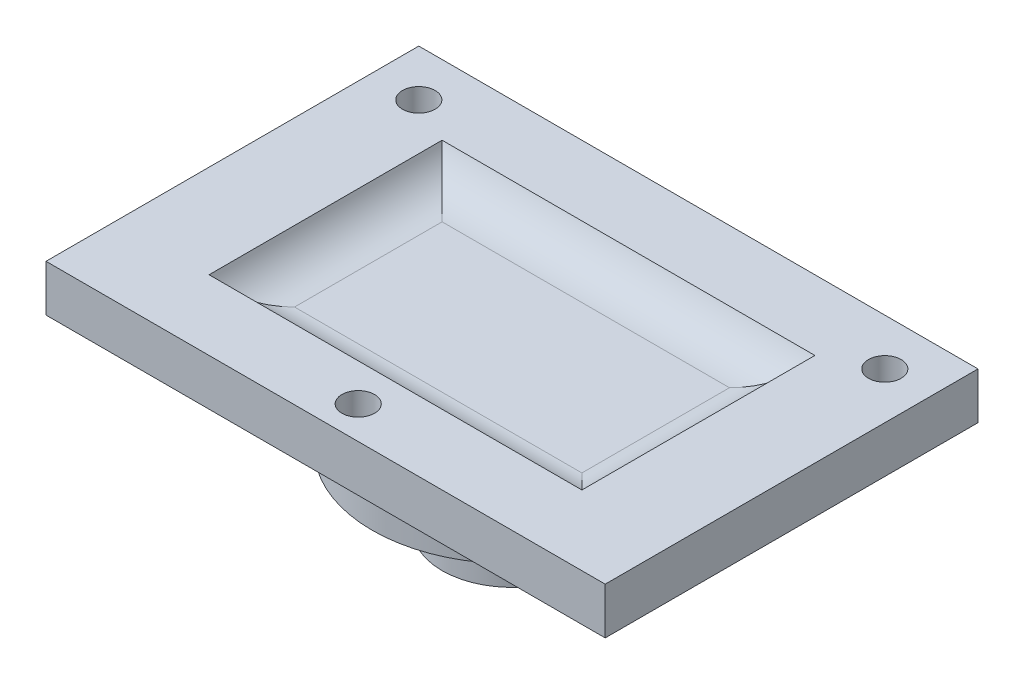
from build123d import *

# Parameters (mm, degrees)
SKETCH1_W             = 120
SKETCH1_H             = 80
BOSS_EXTRUDE1_DEPTH   = 10
SKETCH2_W             = 80
SKETCH2_H             = 50
CUT_EXTRUDE1_DEPTH    = 6
FILLET1_R             = 10
M8X1_0_TAPPED_HOLE2_D = 7
REVOLVE2_START        = -15
REVOLVE2_OUTLINE_R    = 30
REVOLVE2_DEPTH        = 15
REVOLVE2_START_2      = -30
REVOLVE2_2_OUTLINE_R  = 15
REVOLVE2_2_DEPTH      = 15


# Read off the part's stored shape, not the designer's step: Revolve2
with BuildPart() as part:
    # Sketch1 → Boss-Extrude1 (new body)
    with BuildSketch(Plane(origin=(0, 0, 0), x_dir=(1, 0, 0), z_dir=(0, 1, 0))):
        with Locations((39.28083641, -10.118912605)):
            Rectangle(SKETCH1_W, SKETCH1_H)
    extrude(amount=BOSS_EXTRUDE1_DEPTH)

    # Sketch2 → Cut-Extrude1 (cut)
    with BuildSketch(Plane(origin=(0, 10, 0), x_dir=(1, 0, 0), z_dir=(0, 1, 0))):
        with Locations((39.28083641, -10.118912605)):
            Rectangle(SKETCH2_W, SKETCH2_H)
    extrude(amount=-CUT_EXTRUDE1_DEPTH, mode=Mode.SUBTRACT)

    # Fillet1
    # the kernel refuses this fillet: 10 mm, written as the material it adds along each edge
    with BuildSketch(Plane(origin=(79.28083641, 4, 35.118912605), x_dir=(0, 1, 0), z_dir=(-1, 0, 0)), Plane(origin=(-0.71916359, 4, -14.881087395), x_dir=(0, 1, 0), z_dir=(1, 0, 0))) as fillet1_piece_1:
        with BuildLine():
            CenterArc((10, 9.16515139), FILLET1_R, 180, 66.421821522)
            Line((0, 9.16515139), (0, 0))
            Line((0, 0), (6, 0))
        make_face()
    extrude(amount=80)
    with BuildSketch(Plane(origin=(79.28083641, 4, -14.881087395), x_dir=(0, 1, 0), z_dir=(0, 0, 1)), Plane(origin=(-0.71916359, 4, 35.118912605), x_dir=(0, 1, 0), z_dir=(0, 0, -1))) as fillet1_piece_2:
        with BuildLine():
            CenterArc((10, 9.16515139), FILLET1_R, 180, 66.421821522)
            Line((0, 9.16515139), (0, 0))
            Line((0, 0), (6, 0))
        make_face()
    extrude(amount=50)

    # M8x1.0 Tapped Hole2 (through all)
    with Locations(Plane(origin=(-10.71916359, 10, -19.881087395), x_dir=(0, 0, 1), z_dir=(0, 1, 0))):
        with Locations((0, 0), (0, 100), (63, 50)):
            Hole(M8X1_0_TAPPED_HOLE2_D / 2)


with BuildPart() as body_2:
    # Revolve2 outline → Revolve2 (new body)
    with BuildSketch(Plane(origin=(0, 0, 0), x_dir=(1, 0, 0), z_dir=(0, 1, 0)).offset(REVOLVE2_START)):
        with Locations((39.28083641, -10.118912605)):
            Circle(REVOLVE2_OUTLINE_R)
    extrude(amount=REVOLVE2_DEPTH)

    # Revolve2 2 outline → Revolve2 2 (add)
    with BuildSketch(Plane(origin=(0, 0, 0), x_dir=(1, 0, 0), z_dir=(0, 1, 0)).offset(REVOLVE2_START_2)):
        with Locations((39.28083641, -10.118912605)):
            Circle(REVOLVE2_2_OUTLINE_R)
    extrude(amount=REVOLVE2_2_DEPTH)


solid = Compound([part.part, body_2.part])
